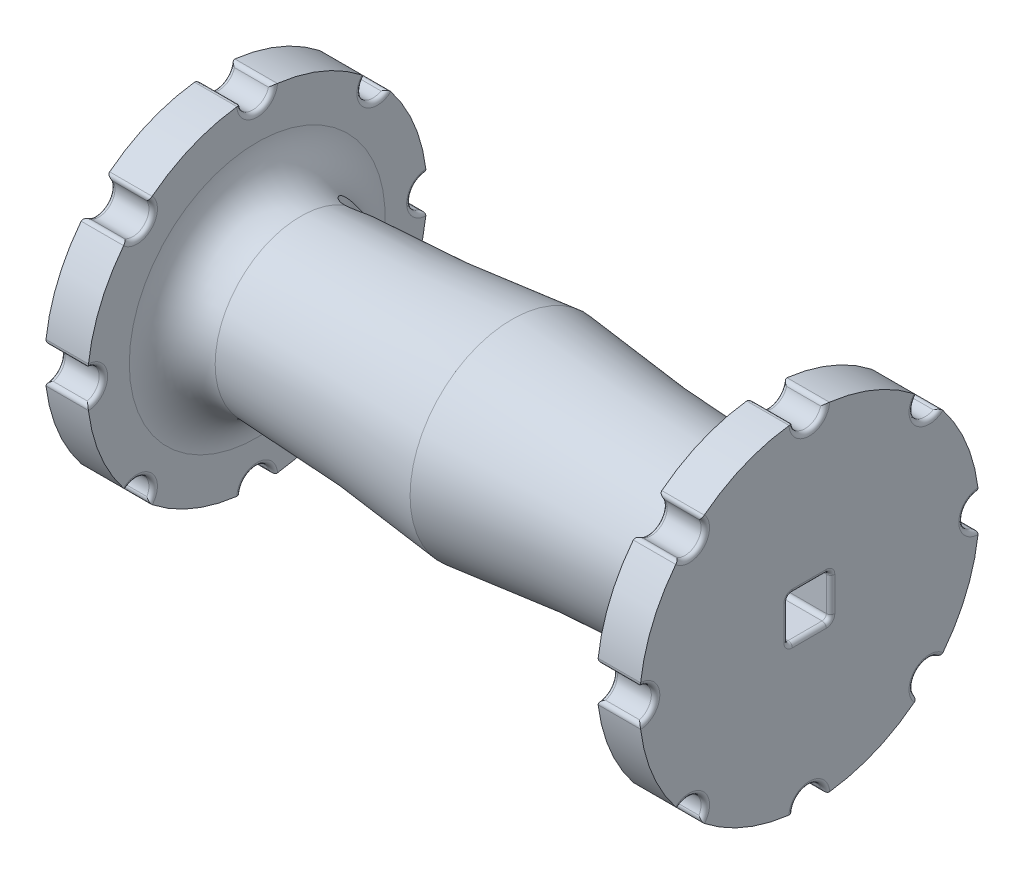
from build123d import *

# Parameters (mm, degrees)
FILLET1_R               = 6.35
SKETCH2_R               = 2.413
SKETCH2_W               = 6.35
SKETCH2_H               = 6.35
CUT_EXTRUDE1_DEPTH      = 96.882897381
FILLET2_R               = 0.635
CUT_EXTRUDE2_DEPTH      = 57.994820559
CUT_EXTRUDE2_DEPTH_BACK = 57.994820559
SKETCH3_R               = 2.328291


with BuildPart() as part:
    # Sketch1 → Revolve1 (revolve)
    with BuildSketch(Plane.XY, mode=Mode.PRIVATE) as revolve1_sk:
        with BuildLine():
            Line((-44.45, 0), (44.45, 0))
            Line((44.45, 0), (44.45, 25.4))
            Line((44.45, 25.4), (38.1, 25.4))
            Line((38.1, 25.4), (38.1, 12.7))
            ThreePointArc((38.1, 12.7), (19.007713599, 13.335703992), (0, 15.24))
            ThreePointArc((0, 15.24), (-19.007713599, 13.335703992), (-38.1, 12.7))
            Line((-38.1, 12.7), (-38.1, 25.4))
            Line((-38.1, 25.4), (-44.45, 25.4))
            Line((-44.45, 25.4), (-44.45, 0))
        make_face()
    revolve(revolve1_sk.sketch.rotate(Axis((0, 0, 0), (1, 0, 0)), 90), axis=Axis((0, 0, 0), (1, 0, 0)))

    # Fillet1
    fillet1_edges = [part.edges().sort_by_distance(p)[0] for p in [
        (38.1, 0, -12.7),
        (-38.1, 0, -12.7),
    ]]
    fillet(fillet1_edges, radius=FILLET1_R)

    # Sketch2 → Cut-Extrude1 (cut, through all)
    with BuildSketch(Plane.ZY.offset(44.45)):
        with Locations((0, 25.4)):
            Circle(SKETCH2_R)
        with Locations((17.960512242, 17.960512242)):
            Circle(SKETCH2_R)
        with Locations((25.4, 0)):
            Circle(SKETCH2_R)
        with Locations((17.960512242, -17.960512242)):
            Circle(SKETCH2_R)
        with Locations((0, -25.4)):
            Circle(SKETCH2_R)
        with Locations((-17.960512242, -17.960512242)):
            Circle(SKETCH2_R)
        with Locations((-25.4, 0)):
            Circle(SKETCH2_R)
        with Locations((-17.960512242, 17.960512242)):
            Circle(SKETCH2_R)
        Rectangle(SKETCH2_W, SKETCH2_H)
    extrude(amount=-CUT_EXTRUDE1_DEPTH, mode=Mode.SUBTRACT)

    # Fillet2
    # the kernel refuses this fillet: 0.635 mm, written as the material it adds along each edge
    with BuildSketch(Plane(origin=(-44.45, 3.175, 3.175), x_dir=(0, -1, 0), z_dir=(1, 0, 0)), Plane(origin=(-44.45, -3.175, -3.175), x_dir=(0, 1, 0), z_dir=(1, 0, 0)), Plane(origin=(-44.45, 3.175, -3.175), x_dir=(0, 0, 1), z_dir=(1, 0, 0))) as fillet2_piece_1:
        with BuildLine():
            CenterArc((FILLET2_R, FILLET2_R), FILLET2_R, 180, 90)
            Line((0, FILLET2_R), (0, 0))
            Line((0, 0), (FILLET2_R, 0))
        make_face()
    extrude(amount=88.9)
    with BuildSketch(Plane(origin=(-44.45, -3.175, 3.175), x_dir=(0, 1, 0), z_dir=(1, 0, 0))) as fillet2_piece_2:
        with BuildLine():
            CenterArc((FILLET2_R, -FILLET2_R), FILLET2_R, 90, 90)
            Line((0, -FILLET2_R), (0, 0))
            Line((0, 0), (FILLET2_R, 0))
        make_face()
    extrude(amount=88.9)
    # the kernel refuses this fillet: 0.635 mm, written as the material it takes off along each edge
    with BuildSketch(Plane(origin=(-44.45, -17.960512242, 17.960512242), x_dir=(0, 0.1731493234730921, 0.9848955842021074), z_dir=(0, -0.9848955842021074, 0.1731493234730921))) as fillet2_2_piece_1:
        with BuildLine():
            CenterArc((2.413 + FILLET2_R, -FILLET2_R), FILLET2_R, 90, 90)
            Line((2.413 + FILLET2_R, 0), (2.413, 0))
            Line((2.413, 0), (2.413, -FILLET2_R))
        make_face()
    revolve(axis=Axis((-44.45, -17.960512242, 17.960512242), (-1, 0, 0)), revolution_arc=250.058043744, mode=Mode.SUBTRACT)
    with BuildSketch(Plane(origin=(-36.582611599, -16.175142716, 19.583788145), x_dir=(0, 0.7785688939946634, 0.6275591424749755), z_dir=(-1, 0, 0)), Plane(origin=(45.967388401, 16.175142716, -19.583788145), x_dir=(0, -0.7785688939946719, -0.627559142474965), z_dir=(-1, 0, 0)), Plane(origin=(45.967388401, -2.410276297, -25.2853825), x_dir=(0, -0.9942826698042065, 0.10678001932486832), z_dir=(-1, 0, 0)), Plane(origin=(45.967388401, -19.583788145, -16.175142716), x_dir=(0, -0.6275591424749747, 0.778568893994664), z_dir=(-1, 0, 0)), Plane(origin=(45.967388401, -25.2853825, 2.410276297), x_dir=(0, 0.10678001932486847, 0.9942826698042065), z_dir=(-1, 0, 0)), Plane(origin=(45.967388401, -16.175142716, 19.583788145), x_dir=(0, 0.7785688939946634, 0.6275591424749755), z_dir=(-1, 0, 0)), Plane(origin=(45.967388401, 19.583788145, 16.175142716), x_dir=(0, 0.6275591424749672, -0.7785688939946701), z_dir=(-1, 0, 0)), Plane(origin=(45.967388401, 25.2853825, -2.410276297), x_dir=(0, -0.10678001932486926, -0.9942826698042064), z_dir=(-1, 0, 0))) as fillet2_2_piece_2:
        with BuildLine():
            CenterArc((0.599368419, 0.634954674), FILLET2_R, 189.280553693, 81.404029141)
            ThreePointArc((-0.027319754, 0.532548941), (0.00109631, 0.267031463), (0, 0))
            ThreePointArc((0, 0), (0.30347768, -0.001813031), (0.606955361, 0))
        make_face()
    extrude(amount=9.384776803, mode=Mode.SUBTRACT)
    with BuildSketch(Plane(origin=(-38.1, -17.960512242, 17.960512242), x_dir=(0, 0.17314932347308612, 0.9848955842021085), z_dir=(0, -0.9848955842021085, 0.17314932347308612))) as fillet2_2_piece_3:
        with BuildLine():
            CenterArc((2.413 + FILLET2_R, FILLET2_R), FILLET2_R, 180, 90)
            Line((2.413, FILLET2_R), (2.413, 0))
            Line((2.413, 0), (2.413 + FILLET2_R, 0))
        make_face()
    revolve(axis=Axis((-38.1, -17.960512242, 17.960512242), (-1, 0, 0)), revolution_arc=250.058043744, mode=Mode.SUBTRACT)
    with BuildSketch(Plane(origin=(-36.582611599, -19.583788145, 16.175142716), x_dir=(0, -0.6275591424749726, -0.7785688939946658), z_dir=(-1, 0, 0)), Plane(origin=(-36.582611599, -25.2853825, -2.410276297), x_dir=(0, 0.10678001932486879, -0.9942826698042064), z_dir=(-1, 0, 0)), Plane(origin=(-36.582611599, -16.175142716, -19.583788145), x_dir=(0, 0.7785688939946611, -0.6275591424749782), z_dir=(-1, 0, 0)), Plane(origin=(-36.582611599, 2.410276297, -25.2853825), x_dir=(0, 0.9942826698042064, 0.10678001932486886), z_dir=(-1, 0, 0)), Plane(origin=(-36.582611599, 19.583788145, -16.175142716), x_dir=(0, 0.6275591424749686, 0.778568893994669), z_dir=(-1, 0, 0)), Plane(origin=(-36.582611599, 25.2853825, 2.410276297), x_dir=(0, -0.10678001932486793, 0.9942826698042065), z_dir=(-1, 0, 0)), Plane(origin=(-36.582611599, 16.175142716, 19.583788145), x_dir=(0, -0.7785688939946668, 0.6275591424749715), z_dir=(-1, 0, 0)), Plane(origin=(-36.582611599, -2.410276297, 25.2853825), x_dir=(0, -0.9942826698042063, -0.10678001932487065), z_dir=(-1, 0, 0))) as fillet2_2_piece_4:
        with BuildLine():
            CenterArc((0.599368419, -0.634954674), FILLET2_R, 89.315417166, 81.404029141)
            ThreePointArc((-0.027319754, -0.532548941), (0.00109631, -0.267031463), (0, 0))
            ThreePointArc((0, 0), (0.30347768, 0.001813031), (0.606955361, 0))
        make_face()
    extrude(amount=9.384776803, mode=Mode.SUBTRACT)
    with BuildSketch(Plane(origin=(38.1, -17.960512242, 17.960512242), x_dir=(0, 0.17314932347308612, 0.9848955842021085), z_dir=(0, -0.9848955842021085, 0.17314932347308612))) as fillet2_2_piece_5:
        with BuildLine():
            CenterArc((2.413 + FILLET2_R, -FILLET2_R), FILLET2_R, 90, 90)
            Line((2.413, -FILLET2_R), (2.413, 0))
            Line((2.413, 0), (2.413 + FILLET2_R, 0))
        make_face()
    revolve(axis=Axis((38.1, -17.960512242, 17.960512242), (-1, 0, 0)), revolution_arc=250.058043744, mode=Mode.SUBTRACT)
    with BuildSketch(Plane(origin=(44.45, -17.960512242, 17.960512242), x_dir=(0, 0.17314932347308612, 0.9848955842021085), z_dir=(0, -0.9848955842021085, 0.17314932347308612))) as fillet2_2_piece_6:
        with BuildLine():
            CenterArc((2.413 + FILLET2_R, FILLET2_R), FILLET2_R, 180, 90)
            Line((2.413 + FILLET2_R, 0), (2.413, 0))
            Line((2.413, 0), (2.413, FILLET2_R))
        make_face()
    revolve(axis=Axis((44.45, -17.960512242, 17.960512242), (-1, 0, 0)), revolution_arc=250.058043744, mode=Mode.SUBTRACT)
    with BuildSketch(Plane(origin=(-44.45, -25.4, 0), x_dir=(0, -0.5739912855642968, 0.8188614071356922), z_dir=(0, -0.8188614071356922, -0.5739912855642968))) as fillet2_2_piece_7:
        with BuildLine():
            CenterArc((2.413 + FILLET2_R, -FILLET2_R), FILLET2_R, 90, 90)
            Line((2.413 + FILLET2_R, 0), (2.413, 0))
            Line((2.413, 0), (2.413, -FILLET2_R))
        make_face()
    revolve(axis=Axis((-44.45, -25.4, 0), (-1, 0, 0)), revolution_arc=250.058043744, mode=Mode.SUBTRACT)
    with BuildSketch(Plane(origin=(-36.582611599, -25.2853825, 2.410276297), x_dir=(0, 0.9875063052805052, -0.1575794943234863), z_dir=(-1, 0, 0)), Plane(origin=(-36.582611599, -19.583788145, -16.175142716), x_dir=(0, 0.809697933940332, 0.5868468759163312), z_dir=(-1, 0, 0)), Plane(origin=(-36.582611599, -2.410276297, -25.2853825), x_dir=(0, 0.1575794943234798, 0.9875063052805062), z_dir=(-1, 0, 0)), Plane(origin=(-36.582611599, 16.175142716, -19.583788145), x_dir=(0, -0.5868468759162333, 0.8096979339404029), z_dir=(-1, 0, 0)), Plane(origin=(45.967388401, 2.410276297, 25.2853825), x_dir=(0, -0.15757949432338272, -0.9875063052805217), z_dir=(-1, 0, 0)), Plane(origin=(-36.582611599, 25.2853825, -2.410276297), x_dir=(0, -0.9875063052805059, 0.15757949432348287), z_dir=(-1, 0, 0)), Plane(origin=(-36.582611599, 19.583788145, 16.175142716), x_dir=(0, -0.8096979339404029, -0.5868468759162333), z_dir=(-1, 0, 0)), Plane(origin=(-36.582611599, 2.410276297, 25.2853825), x_dir=(0, -0.15757949432338272, -0.9875063052805217), z_dir=(-1, 0, 0))) as fillet2_2_piece_8:
        with BuildLine():
            CenterArc((0.603413605, -0.631111686), FILLET2_R, 96.343855255, 81.404029141)
            ThreePointArc((-0.031095912, -0.606158275), (-0.017358606, -0.302986251), (0, 0))
            ThreePointArc((0, 0), (0.266624616, -0.014775591), (0.533249232, 0))
        make_face()
    extrude(amount=9.384776803, mode=Mode.SUBTRACT)
    with BuildSketch(Plane(origin=(-38.1, -25.4, 0), x_dir=(0, -0.5739912855643129, 0.8188614071356808), z_dir=(0, -0.8188614071356808, -0.5739912855643129))) as fillet2_2_piece_9:
        with BuildLine():
            CenterArc((2.413 + FILLET2_R, FILLET2_R), FILLET2_R, 180, 90)
            Line((2.413, FILLET2_R), (2.413, 0))
            Line((2.413, 0), (2.413 + FILLET2_R, 0))
        make_face()
    revolve(axis=Axis((-38.1, -25.4, 0), (-1, 0, 0)), revolution_arc=250.058043744, mode=Mode.SUBTRACT)
    with BuildSketch(Plane(origin=(38.1, -25.4, 0), x_dir=(0, -0.5739912855643129, 0.8188614071356808), z_dir=(0, -0.8188614071356808, -0.5739912855643129))) as fillet2_2_piece_10:
        with BuildLine():
            CenterArc((2.413 + FILLET2_R, -FILLET2_R), FILLET2_R, 90, 90)
            Line((2.413, -FILLET2_R), (2.413, 0))
            Line((2.413, 0), (2.413 + FILLET2_R, 0))
        make_face()
    revolve(axis=Axis((38.1, -25.4, 0), (-1, 0, 0)), revolution_arc=250.058043744, mode=Mode.SUBTRACT)
    with BuildSketch(Plane(origin=(44.45, -25.4, 0), x_dir=(0, -0.5739912855643129, 0.8188614071356808), z_dir=(0, -0.8188614071356808, -0.5739912855643129))) as fillet2_2_piece_11:
        with BuildLine():
            CenterArc((2.413 + FILLET2_R, FILLET2_R), FILLET2_R, 180, 90)
            Line((2.413 + FILLET2_R, 0), (2.413, 0))
            Line((2.413, 0), (2.413, FILLET2_R))
        make_face()
    revolve(axis=Axis((44.45, -25.4, 0), (-1, 0, 0)), revolution_arc=250.058043744, mode=Mode.SUBTRACT)
    with BuildSketch(Plane(origin=(-44.45, -17.960512242, -17.960512242), x_dir=(0, -0.984895584202107, 0.17314932347309442), z_dir=(0, -0.17314932347309442, -0.984895584202107))) as fillet2_2_piece_12:
        with BuildLine():
            CenterArc((2.413 + FILLET2_R, -FILLET2_R), FILLET2_R, 90, 90)
            Line((2.413 + FILLET2_R, 0), (2.413, 0))
            Line((2.413, 0), (2.413, -FILLET2_R))
        make_face()
    revolve(axis=Axis((-44.45, -17.960512242, -17.960512242), (-1, 0, 0)), revolution_arc=250.058043744, mode=Mode.SUBTRACT)
    with BuildSketch(Plane(origin=(-38.1, -17.960512242, -17.960512242), x_dir=(2.9446445742233716e-15, -0.9848955842021081, 0.17314932347308848), z_dir=(0, -0.17314932347308848, -0.9848955842021081))) as fillet2_2_piece_13:
        with BuildLine():
            CenterArc((2.413 + FILLET2_R, FILLET2_R), FILLET2_R, 180, 90)
            Line((2.413, FILLET2_R), (2.413, 0))
            Line((2.413, 0), (2.413 + FILLET2_R, 0))
        make_face()
    revolve(axis=Axis((-38.1, -17.960512242, -17.960512242), (-1, 0, 0)), revolution_arc=250.058043744, mode=Mode.SUBTRACT)
    with BuildSketch(Plane(origin=(38.1, -17.960512242, -17.960512242), x_dir=(0, 0.17314932347308848, -0.9848955842021081), z_dir=(3.919695014070006e-15, -0.9848955842021081, -0.17314932347308848))) as fillet2_2_piece_14:
        with BuildLine():
            CenterArc((2.413 + FILLET2_R, FILLET2_R), FILLET2_R, 180, 90)
            Line((2.413, FILLET2_R), (2.413, 0))
            Line((2.413, 0), (2.413 + FILLET2_R, 0))
        make_face()
    revolve(axis=Axis((38.1, -17.960512242, -17.960512242), (1, 0, 0)), revolution_arc=250.058043744, mode=Mode.SUBTRACT)
    with BuildSketch(Plane(origin=(44.45, -17.960512242, -17.960512242), x_dir=(0, 0.17314932347308848, -0.9848955842021081), z_dir=(3.919695014070006e-15, -0.9848955842021081, -0.17314932347308848))) as fillet2_2_piece_15:
        with BuildLine():
            CenterArc((2.413 + FILLET2_R, -FILLET2_R), FILLET2_R, 90, 90)
            Line((2.413 + FILLET2_R, 0), (2.413, 0))
            Line((2.413, 0), (2.413, -FILLET2_R))
        make_face()
    revolve(axis=Axis((44.45, -17.960512242, -17.960512242), (1, 0, 0)), revolution_arc=250.058043744, mode=Mode.SUBTRACT)
    with BuildSketch(Plane(origin=(-44.45, 0, -25.4), x_dir=(0, -0.8188614071356876, -0.5739912855643036), z_dir=(0, 0.5739912855643036, -0.8188614071356876))) as fillet2_2_piece_16:
        with BuildLine():
            CenterArc((2.413 + FILLET2_R, -FILLET2_R), FILLET2_R, 90, 90)
            Line((2.413 + FILLET2_R, 0), (2.413, 0))
            Line((2.413, 0), (2.413, -FILLET2_R))
        make_face()
    revolve(axis=Axis((-44.45, 0, -25.4), (-1, 0, 0)), revolution_arc=250.058043744, mode=Mode.SUBTRACT)
    with BuildSketch(Plane(origin=(-38.1, 0, -25.4), x_dir=(2.9446445742233724e-15, -0.8188614071356813, -0.5739912855643124), z_dir=(-1.6921103145991468e-15, 0.5739912855643124, -0.8188614071356813))) as fillet2_2_piece_17:
        with BuildLine():
            CenterArc((2.413 + FILLET2_R, FILLET2_R), FILLET2_R, 180, 90)
            Line((2.413, FILLET2_R), (2.413, 0))
            Line((2.413, 0), (2.413 + FILLET2_R, 0))
        make_face()
    revolve(axis=Axis((-38.1, 0, -25.4), (-1, 0, 0)), revolution_arc=250.058043744, mode=Mode.SUBTRACT)
    with BuildSketch(Plane(origin=(38.1, 0, -25.4), x_dir=(-2.9446445742233724e-15, 0.8188614071356813, -0.5739912855643124), z_dir=(1.6921103145991491e-15, -0.5739912855643124, -0.8188614071356813))) as fillet2_2_piece_18:
        with BuildLine():
            CenterArc((2.413 + FILLET2_R, FILLET2_R), FILLET2_R, 180, 90)
            Line((2.413, FILLET2_R), (2.413, 0))
            Line((2.413, 0), (2.413 + FILLET2_R, 0))
        make_face()
    revolve(axis=Axis((38.1, 0, -25.4), (1, 0, 0)), revolution_arc=250.058043744, mode=Mode.SUBTRACT)
    with BuildSketch(Plane(origin=(44.45, 0, -25.4), x_dir=(-2.9446445742233724e-15, 0.8188614071356813, -0.5739912855643124), z_dir=(1.6921103145991491e-15, -0.5739912855643124, -0.8188614071356813))) as fillet2_2_piece_19:
        with BuildLine():
            CenterArc((2.413 + FILLET2_R, -FILLET2_R), FILLET2_R, 90, 90)
            Line((2.413 + FILLET2_R, 0), (2.413, 0))
            Line((2.413, 0), (2.413, -FILLET2_R))
        make_face()
    revolve(axis=Axis((44.45, 0, -25.4), (1, 0, 0)), revolution_arc=250.058043744, mode=Mode.SUBTRACT)
    with BuildSketch(Plane(origin=(-44.45, 17.960512242, -17.960512242), x_dir=(0, -0.17314932347309586, -0.9848955842021068), z_dir=(0, 0.9848955842021068, -0.17314932347309586))) as fillet2_2_piece_20:
        with BuildLine():
            CenterArc((2.413 + FILLET2_R, -FILLET2_R), FILLET2_R, 90, 90)
            Line((2.413 + FILLET2_R, 0), (2.413, 0))
            Line((2.413, 0), (2.413, -FILLET2_R))
        make_face()
    revolve(axis=Axis((-44.45, 17.960512242, -17.960512242), (-1, 0, 0)), revolution_arc=250.058043744, mode=Mode.SUBTRACT)
    with BuildSketch(Plane(origin=(-38.1, 17.960512242, -17.960512242), x_dir=(0, -0.17314932347308992, -0.9848955842021079), z_dir=(-3.919695014069873e-15, 0.9848955842021079, -0.17314932347308992))) as fillet2_2_piece_21:
        with BuildLine():
            CenterArc((2.413 + FILLET2_R, FILLET2_R), FILLET2_R, 180, 90)
            Line((2.413, FILLET2_R), (2.413, 0))
            Line((2.413, 0), (2.413 + FILLET2_R, 0))
        make_face()
    revolve(axis=Axis((-38.1, 17.960512242, -17.960512242), (-1, 0, 0)), revolution_arc=250.058043744, mode=Mode.SUBTRACT)
    with BuildSketch(Plane(origin=(38.1, 17.960512242, -17.960512242), x_dir=(-2.94464457422337e-15, 0.9848955842021075, 0.1731493234730913), z_dir=(0, 0.1731493234730913, -0.9848955842021075))) as fillet2_2_piece_22:
        with BuildLine():
            CenterArc((2.413 + FILLET2_R, FILLET2_R), FILLET2_R, 180, 90)
            Line((2.413, FILLET2_R), (2.413, 0))
            Line((2.413, 0), (2.413 + FILLET2_R, 0))
        make_face()
    revolve(axis=Axis((38.1, 17.960512242, -17.960512242), (1, 0, 0)), revolution_arc=250.058043744, mode=Mode.SUBTRACT)
    with BuildSketch(Plane(origin=(44.45, 17.960512242, -17.960512242), x_dir=(-2.94464457422337e-15, 0.9848955842021075, 0.1731493234730913), z_dir=(0, 0.1731493234730913, -0.9848955842021075))) as fillet2_2_piece_23:
        with BuildLine():
            CenterArc((2.413 + FILLET2_R, -FILLET2_R), FILLET2_R, 90, 90)
            Line((2.413 + FILLET2_R, 0), (2.413, 0))
            Line((2.413, 0), (2.413, -FILLET2_R))
        make_face()
    revolve(axis=Axis((44.45, 17.960512242, -17.960512242), (1, 0, 0)), revolution_arc=250.058043744, mode=Mode.SUBTRACT)
    with BuildSketch(Plane(origin=(45.967388401, 19.583788145, -16.175142716), x_dir=(0, -0.8096979339403984, 0.5868468759162396), z_dir=(-1, 0, 0)), Plane(origin=(45.967388401, 2.410276297, -25.2853825), x_dir=(0, -0.15757949432348145, 0.987506305280506), z_dir=(-1, 0, 0)), Plane(origin=(45.967388401, -16.175142716, -19.583788145), x_dir=(0, 0.5868468759163312, 0.809697933940332), z_dir=(-1, 0, 0)), Plane(origin=(45.967388401, -25.2853825, -2.410276297), x_dir=(0, 0.9875063052805052, 0.15757949432348692), z_dir=(-1, 0, 0)), Plane(origin=(45.967388401, -19.583788145, 16.175142716), x_dir=(0, 0.8096979339403397, -0.5868468759163206), z_dir=(-1, 0, 0)), Plane(origin=(45.967388401, -2.410276297, 25.2853825), x_dir=(0, 0.15757949432338494, -0.9875063052805214), z_dir=(-1, 0, 0)), Plane(origin=(45.967388401, 16.175142716, 19.583788145), x_dir=(0, -0.5868468759162364, -0.8096979339404006), z_dir=(-1, 0, 0)), Plane(origin=(45.967388401, 25.2853825, 2.410276297), x_dir=(0, -0.9875063052805055, -0.1575794943234839), z_dir=(-1, 0, 0))) as fillet2_2_piece_24:
        with BuildLine():
            CenterArc((0.603413605, 0.631111686), FILLET2_R, 182.252115604, 81.404029141)
            ThreePointArc((-0.031095912, 0.606158275), (-0.017358606, 0.302986251), (0, 0))
            ThreePointArc((0, 0), (0.266624616, 0.014775591), (0.533249232, 0))
        make_face()
    extrude(amount=9.384776803, mode=Mode.SUBTRACT)
    with BuildSketch(Plane(origin=(-44.45, 25.4, 0), x_dir=(0, 0.5739912855642965, -0.8188614071356924), z_dir=(0, 0.8188614071356924, 0.5739912855642965))) as fillet2_2_piece_25:
        with BuildLine():
            CenterArc((2.413 + FILLET2_R, -FILLET2_R), FILLET2_R, 90, 90)
            Line((2.413 + FILLET2_R, 0), (2.413, 0))
            Line((2.413, 0), (2.413, -FILLET2_R))
        make_face()
    revolve(axis=Axis((-44.45, 25.4, 0), (-1, 0, 0)), revolution_arc=250.058043744, mode=Mode.SUBTRACT)
    with BuildSketch(Plane(origin=(-38.1, 25.4, 0), x_dir=(0, 0.5739912855643127, -0.818861407135681), z_dir=(0, 0.818861407135681, 0.5739912855643127))) as fillet2_2_piece_26:
        with BuildLine():
            CenterArc((2.413 + FILLET2_R, FILLET2_R), FILLET2_R, 180, 90)
            Line((2.413, FILLET2_R), (2.413, 0))
            Line((2.413, 0), (2.413 + FILLET2_R, 0))
        make_face()
    revolve(axis=Axis((-38.1, 25.4, 0), (-1, 0, 0)), revolution_arc=250.058043744, mode=Mode.SUBTRACT)
    with BuildSketch(Plane(origin=(38.1, 25.4, 0), x_dir=(0, 0.5739912855643127, -0.818861407135681), z_dir=(0, 0.818861407135681, 0.5739912855643127))) as fillet2_2_piece_27:
        with BuildLine():
            CenterArc((2.413 + FILLET2_R, -FILLET2_R), FILLET2_R, 90, 90)
            Line((2.413, -FILLET2_R), (2.413, 0))
            Line((2.413, 0), (2.413 + FILLET2_R, 0))
        make_face()
    revolve(axis=Axis((38.1, 25.4, 0), (-1, 0, 0)), revolution_arc=250.058043744, mode=Mode.SUBTRACT)
    with BuildSketch(Plane(origin=(44.45, 25.4, 0), x_dir=(0, 0.5739912855643127, -0.818861407135681), z_dir=(0, 0.818861407135681, 0.5739912855643127))) as fillet2_2_piece_28:
        with BuildLine():
            CenterArc((2.413 + FILLET2_R, FILLET2_R), FILLET2_R, 180, 90)
            Line((2.413 + FILLET2_R, 0), (2.413, 0))
            Line((2.413, 0), (2.413, FILLET2_R))
        make_face()
    revolve(axis=Axis((44.45, 25.4, 0), (-1, 0, 0)), revolution_arc=250.058043744, mode=Mode.SUBTRACT)
    with BuildSketch(Plane(origin=(-44.45, 17.960512242, 17.960512242), x_dir=(0, 0.9848955842021064, -0.17314932347309728), z_dir=(0, 0.17314932347309728, 0.9848955842021064))) as fillet2_2_piece_29:
        with BuildLine():
            CenterArc((2.413 + FILLET2_R, -FILLET2_R), FILLET2_R, 90, 90)
            Line((2.413 + FILLET2_R, 0), (2.413, 0))
            Line((2.413, 0), (2.413, -FILLET2_R))
        make_face()
    revolve(axis=Axis((-44.45, 17.960512242, 17.960512242), (-1, 0, 0)), revolution_arc=250.058043744, mode=Mode.SUBTRACT)
    with BuildSketch(Plane(origin=(-38.1, 17.960512242, 17.960512242), x_dir=(0, 0.9848955842021079, -0.17314932347308992), z_dir=(0, 0.17314932347308992, 0.9848955842021079))) as fillet2_2_piece_30:
        with BuildLine():
            CenterArc((2.413 + FILLET2_R, FILLET2_R), FILLET2_R, 180, 90)
            Line((2.413, FILLET2_R), (2.413, 0))
            Line((2.413, 0), (2.413 + FILLET2_R, 0))
        make_face()
    revolve(axis=Axis((-38.1, 17.960512242, 17.960512242), (-1, 0, 0)), revolution_arc=250.058043744, mode=Mode.SUBTRACT)
    with BuildSketch(Plane(origin=(38.1, 17.960512242, 17.960512242), x_dir=(0, 0.9848955842021079, -0.17314932347308992), z_dir=(0, 0.17314932347308992, 0.9848955842021079))) as fillet2_2_piece_31:
        with BuildLine():
            CenterArc((2.413 + FILLET2_R, -FILLET2_R), FILLET2_R, 90, 90)
            Line((2.413, -FILLET2_R), (2.413, 0))
            Line((2.413, 0), (2.413 + FILLET2_R, 0))
        make_face()
    revolve(axis=Axis((38.1, 17.960512242, 17.960512242), (-1, 0, 0)), revolution_arc=250.058043744, mode=Mode.SUBTRACT)
    with BuildSketch(Plane(origin=(44.45, 17.960512242, 17.960512242), x_dir=(0, 0.9848955842021079, -0.17314932347308992), z_dir=(0, 0.17314932347308992, 0.9848955842021079))) as fillet2_2_piece_32:
        with BuildLine():
            CenterArc((2.413 + FILLET2_R, FILLET2_R), FILLET2_R, 180, 90)
            Line((2.413 + FILLET2_R, 0), (2.413, 0))
            Line((2.413, 0), (2.413, FILLET2_R))
        make_face()
    revolve(axis=Axis((44.45, 17.960512242, 17.960512242), (-1, 0, 0)), revolution_arc=250.058043744, mode=Mode.SUBTRACT)
    with BuildSketch(Plane(origin=(-44.45, 0, 25.4), x_dir=(0, 0.8188614071356863, 0.5739912855643051), z_dir=(0, -0.5739912855643051, 0.8188614071356863))) as fillet2_2_piece_33:
        with BuildLine():
            CenterArc((2.413 + FILLET2_R, -FILLET2_R), FILLET2_R, 90, 90)
            Line((2.413 + FILLET2_R, 0), (2.413, 0))
            Line((2.413, 0), (2.413, -FILLET2_R))
        make_face()
    revolve(axis=Axis((-44.45, 0, 25.4), (-1, 0, 0)), revolution_arc=250.058043744, mode=Mode.SUBTRACT)
    with BuildSketch(Plane(origin=(-38.1, 0, 25.4), x_dir=(0, 0.8188614071356791, 0.5739912855643156), z_dir=(0, -0.5739912855643156, 0.8188614071356791))) as fillet2_2_piece_34:
        with BuildLine():
            CenterArc((2.413 + FILLET2_R, FILLET2_R), FILLET2_R, 180, 90)
            Line((2.413, FILLET2_R), (2.413, 0))
            Line((2.413, 0), (2.413 + FILLET2_R, 0))
        make_face()
    revolve(axis=Axis((-38.1, 0, 25.4), (-1, 0, 0)), revolution_arc=250.058043744, mode=Mode.SUBTRACT)
    with BuildSketch(Plane(origin=(38.1, 0, 25.4), x_dir=(0, 0.8188614071356791, 0.5739912855643156), z_dir=(0, -0.5739912855643156, 0.8188614071356791))) as fillet2_2_piece_35:
        with BuildLine():
            CenterArc((2.413 + FILLET2_R, -FILLET2_R), FILLET2_R, 90, 90)
            Line((2.413, -FILLET2_R), (2.413, 0))
            Line((2.413, 0), (2.413 + FILLET2_R, 0))
        make_face()
    revolve(axis=Axis((38.1, 0, 25.4), (-1, 0, 0)), revolution_arc=250.058043744, mode=Mode.SUBTRACT)
    with BuildSketch(Plane(origin=(44.45, 0, 25.4), x_dir=(0, 0.8188614071356791, 0.5739912855643156), z_dir=(0, -0.5739912855643156, 0.8188614071356791))) as fillet2_2_piece_36:
        with BuildLine():
            CenterArc((2.413 + FILLET2_R, FILLET2_R), FILLET2_R, 180, 90)
            Line((2.413 + FILLET2_R, 0), (2.413, 0))
            Line((2.413, 0), (2.413, FILLET2_R))
        make_face()
    revolve(axis=Axis((44.45, 0, 25.4), (-1, 0, 0)), revolution_arc=250.058043744, mode=Mode.SUBTRACT)
    # the kernel refuses this fillet: 0.635 mm, written as the material it takes off along each edge
    with BuildSketch(Plane(origin=(44.45, -2.54, 3.175), x_dir=(-1, 0, 0), z_dir=(0, 1, 0)), Plane(origin=(44.45, -3.175, -2.54), x_dir=(-1, 0, 0), z_dir=(0, 0, 1)), Plane(origin=(44.45, 2.54, -3.175), x_dir=(-1, 0, 0), z_dir=(0, -1, 0)), Plane(origin=(44.45, 3.175, 2.54), x_dir=(-1, 0, 0), z_dir=(0, 0, -1)), Plane(origin=(-44.45, -2.54, 3.175), x_dir=(0, 0, 1), z_dir=(0, 1, 0)), Plane(origin=(-44.45, 3.175, 2.54), x_dir=(0, 1, 0), z_dir=(0, 0, -1)), Plane(origin=(-44.45, 2.54, -3.175), x_dir=(0, 0, -1), z_dir=(0, -1, 0)), Plane(origin=(-44.45, -3.175, -2.54), x_dir=(0, -1, 0), z_dir=(0, 0, 1))) as fillet2_3_piece_1:
        with BuildLine():
            CenterArc((FILLET2_R, FILLET2_R), FILLET2_R, 180, 90)
            Line((0, FILLET2_R), (0, 0))
            Line((0, 0), (FILLET2_R, 0))
        make_face()
    extrude(amount=5.08, mode=Mode.SUBTRACT)
    with BuildSketch(Plane(origin=(-44.45, -2.54, -2.54), x_dir=(0, 0, -1), z_dir=(0, 1, 0))) as fillet2_3_piece_2:
        with BuildLine():
            CenterArc((0.635 + FILLET2_R, -FILLET2_R), FILLET2_R, 90, 90)
            Line((0.635, -FILLET2_R), (0.635, 0))
            Line((0.635, 0), (0.635 + FILLET2_R, 0))
        make_face()
    revolve(axis=Axis((-44.45, -2.54, -2.54), (-1, 0, 0)), revolution_arc=90, mode=Mode.SUBTRACT)
    with BuildSketch(Plane(origin=(-44.45, -2.54, 2.54), x_dir=(0, 0, 1), z_dir=(0, 1, 0))) as fillet2_3_piece_3:
        with BuildLine():
            CenterArc((0.635 + FILLET2_R, FILLET2_R), FILLET2_R, 180, 90)
            Line((0.635, FILLET2_R), (0.635, 0))
            Line((0.635, 0), (0.635 + FILLET2_R, 0))
        make_face()
    revolve(axis=Axis((-44.45, -2.54, 2.54), (1, 0, 0)), revolution_arc=90, mode=Mode.SUBTRACT)
    with BuildSketch(Plane(origin=(-44.45, 2.54, -2.54), x_dir=(0, 1, 0), z_dir=(0, 0, 1))) as fillet2_3_piece_4:
        with BuildLine():
            CenterArc((0.635 + FILLET2_R, -FILLET2_R), FILLET2_R, 90, 90)
            Line((0.635, -FILLET2_R), (0.635, 0))
            Line((0.635, 0), (0.635 + FILLET2_R, 0))
        make_face()
    revolve(axis=Axis((-44.45, 2.54, -2.54), (-1, 0, 0)), revolution_arc=90, mode=Mode.SUBTRACT)
    with BuildSketch(Plane(origin=(-44.45, 2.54, 2.54), x_dir=(0, 0, 1), z_dir=(0, -1, 0))) as fillet2_3_piece_5:
        with BuildLine():
            CenterArc((0.635 + FILLET2_R, -FILLET2_R), FILLET2_R, 90, 90)
            Line((0.635, -FILLET2_R), (0.635, 0))
            Line((0.635, 0), (0.635 + FILLET2_R, 0))
        make_face()
    revolve(axis=Axis((-44.45, 2.54, 2.54), (-1, 0, 0)), revolution_arc=90, mode=Mode.SUBTRACT)
    with BuildSketch(Plane(origin=(44.45, 2.54, 2.54), x_dir=(0, 0, 1), z_dir=(0, -1, 0))) as fillet2_3_piece_6:
        with BuildLine():
            CenterArc((0.635 + FILLET2_R, FILLET2_R), FILLET2_R, 180, 90)
            Line((0.635 + FILLET2_R, 0), (0.635, 0))
            Line((0.635, 0), (0.635, FILLET2_R))
        make_face()
    revolve(axis=Axis((44.45, 2.54, 2.54), (-1, 0, 0)), revolution_arc=90, mode=Mode.SUBTRACT)
    with BuildSketch(Plane(origin=(44.45, 2.54, -2.54), x_dir=(0, 1, 0), z_dir=(0, 0, 1))) as fillet2_3_piece_7:
        with BuildLine():
            CenterArc((0.635 + FILLET2_R, FILLET2_R), FILLET2_R, 180, 90)
            Line((0.635 + FILLET2_R, 0), (0.635, 0))
            Line((0.635, 0), (0.635, FILLET2_R))
        make_face()
    revolve(axis=Axis((44.45, 2.54, -2.54), (-1, 0, 0)), revolution_arc=90, mode=Mode.SUBTRACT)
    with BuildSketch(Plane(origin=(44.45, -2.54, -2.54), x_dir=(0, 0, -1), z_dir=(0, 1, 0))) as fillet2_3_piece_8:
        with BuildLine():
            CenterArc((0.635 + FILLET2_R, FILLET2_R), FILLET2_R, 180, 90)
            Line((0.635 + FILLET2_R, 0), (0.635, 0))
            Line((0.635, 0), (0.635, FILLET2_R))
        make_face()
    revolve(axis=Axis((44.45, -2.54, -2.54), (-1, 0, 0)), revolution_arc=90, mode=Mode.SUBTRACT)
    with BuildSketch(Plane(origin=(44.45, -2.54, 2.54), x_dir=(0, 0, 1), z_dir=(0, 1, 0))) as fillet2_3_piece_9:
        with BuildLine():
            CenterArc((0.635 + FILLET2_R, -FILLET2_R), FILLET2_R, 90, 90)
            Line((0.635 + FILLET2_R, 0), (0.635, 0))
            Line((0.635, 0), (0.635, -FILLET2_R))
        make_face()
    revolve(axis=Axis((44.45, -2.54, 2.54), (1, 0, 0)), revolution_arc=90, mode=Mode.SUBTRACT)

    # Sketch3 → Cut-Extrude2 (cut, two sides: drawn at the far end of the back side and taken through both)
    with BuildSketch(Plane(origin=(0, 0, 0), x_dir=(1, 0, 0), z_dir=(0, 1, 0)).offset(-CUT_EXTRUDE2_DEPTH_BACK)):
        with Locations(Location((-31.606334842, 8.89, 0), (0, 0, 270))):
            Circle(SKETCH3_R)
        with Locations(Location((31.606334842, 8.89, 0), (0, 0, 270))):
            Circle(SKETCH3_R)
    extrude(amount=CUT_EXTRUDE2_DEPTH + CUT_EXTRUDE2_DEPTH_BACK, mode=Mode.SUBTRACT)


solid = part.part
